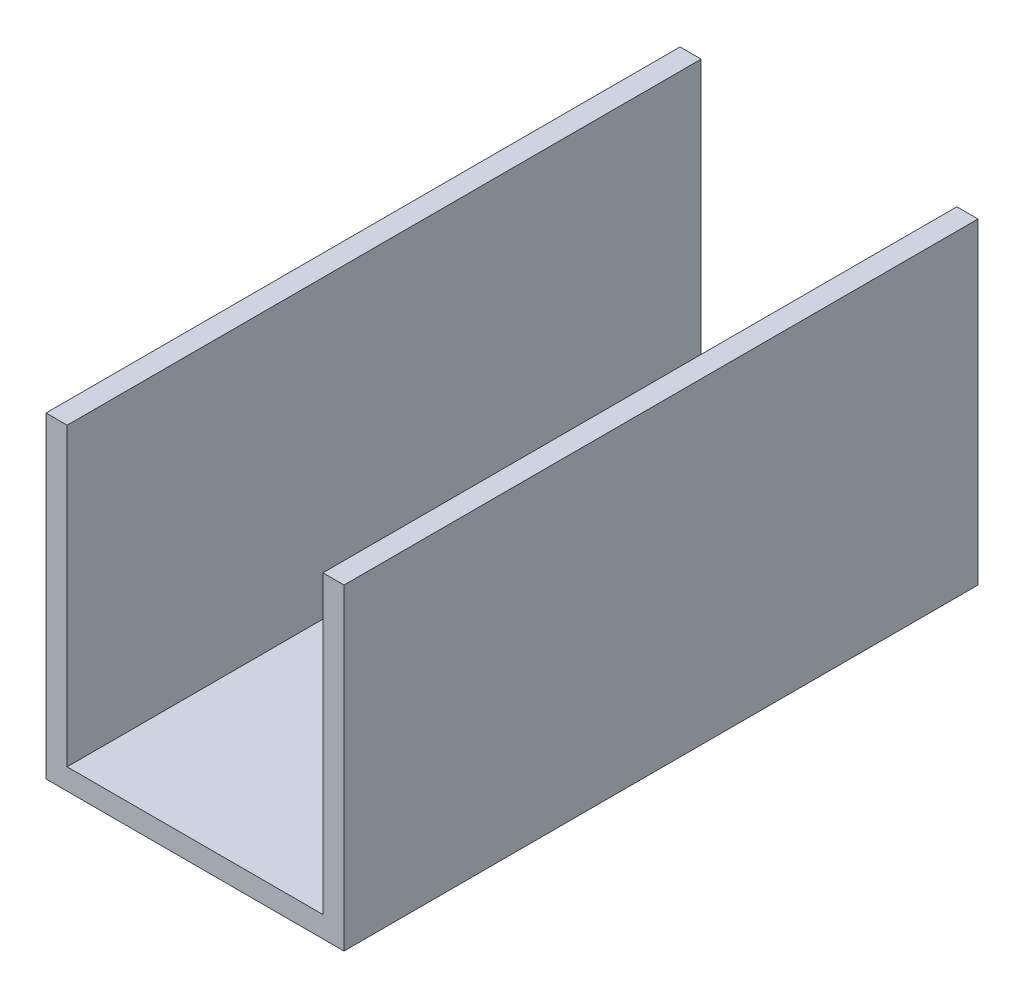
from build123d import *

# Parameters (mm, degrees)
BOSS_EXTRUDE1_DEPTH = 60


with BuildPart() as part:
    # Sketch2 → Boss-Extrude1 (new, symmetric)
    with BuildSketch(Plane.XY):
        Polygon((-24.2, 0), (24.2, 0), (24.2, 56), (28.2, 56), (28.2, -4), (-28.2, -4), (-28.2, 56), (-24.2, 56), align=None)
    extrude(amount=BOSS_EXTRUDE1_DEPTH, both=True)


solid = part.part
